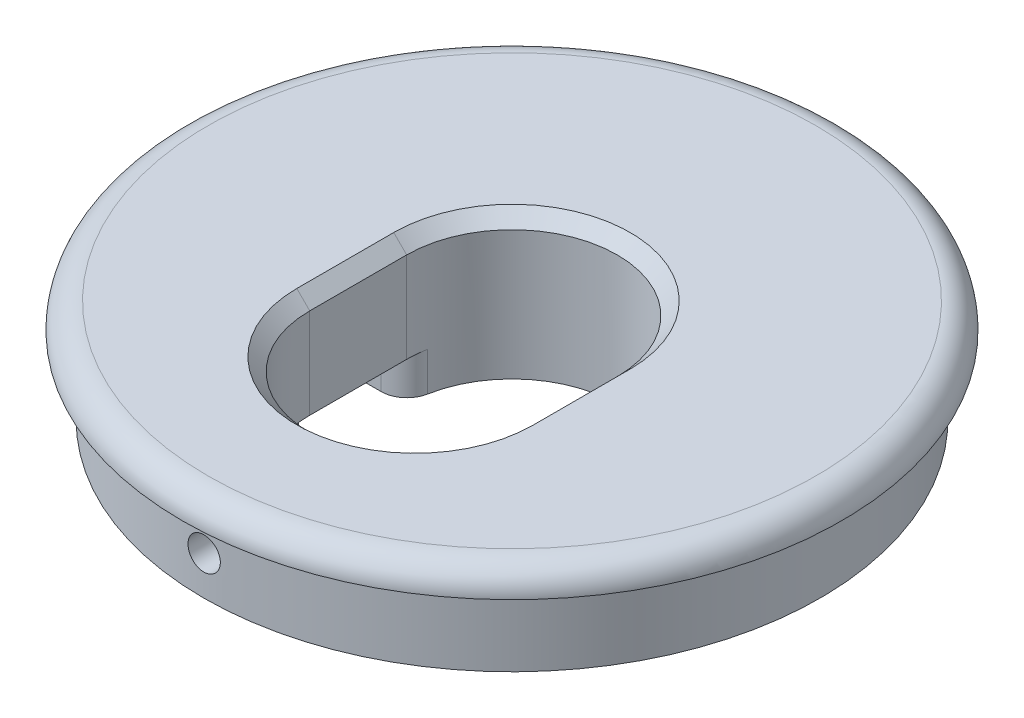
from build123d import *

# Parameters (mm, degrees)
SKETCH1_R           = 23.85
BOSS_EXTRUDE1_DEPTH = 6
SKETCH2_R           = 25.5
BOSS_EXTRUDE2_DEPTH = 2
FILLET1_R           = 2
CUT_EXTRUDE1_DEPTH  = 37.939139135
BOSS_EXTRUDE3_DEPTH = 3
SKETCH5_W           = 28
SKETCH5_H           = 7.2
CUT_EXTRUDE2_DEPTH  = 3
SKETCH6_R           = 1.25
CUT_EXTRUDE3_DEPTH  = 5
FILLET2_R           = 2
CHAMFER1_SIZE       = 1
SKETCH7_W           = 1.25
SKETCH7_H           = 8


# Some blends are built 0.0001 mm under size
with BuildPart() as part:
    # Sketch1 → Boss-Extrude1 (new body)
    with BuildSketch(Plane(origin=(0, 0, 0), x_dir=(1, 0, 0), z_dir=(0, 1, 0))):
        with Locations(Location((0, 0, 0), (0, 0, 270))):
            Circle(SKETCH1_R)
    extrude(amount=BOSS_EXTRUDE1_DEPTH)

    # Sketch2 → Boss-Extrude2 (add)
    with BuildSketch(Plane(origin=(0, 6, 0), x_dir=(1, 0, 0), z_dir=(0, 1, 0))):
        with Locations(Location((0, 0, 0), (0, 0, 270))):
            Circle(SKETCH2_R)
    extrude(amount=BOSS_EXTRUDE2_DEPTH)

    # Fillet1
    fillet1_edges = [part.edges().sort_by_distance(p)[0] for p in [
        (0, 8, -25.5),
    ]]
    fillet(fillet1_edges, radius=FILLET1_R - 0.0001)  # a hair under: the kernel refuses the full size

    # Sketch3 → Cut-Extrude1 (cut, through all)
    with BuildSketch(Plane(origin=(0, 8, 0), x_dir=(1, 0, 0), z_dir=(0, 1, 0))):
        with BuildLine():
            Line((8.15, 0), (8.15, -7.5))
            ThreePointArc((8.15, -7.5), (0, -15.65), (-8.15, -7.5))
            Line((-8.15, -7.5), (-8.15, 0))
            ThreePointArc((-8.15, 0), (0, 8.15), (8.15, 0))
        make_face()
    extrude(amount=-CUT_EXTRUDE1_DEPTH, mode=Mode.SUBTRACT)

    # Sketch4 → Boss-Extrude3 (add)
    with BuildSketch(Plane.XZ):
        with BuildLine():
            Line((-12.15, 7.5), (-12.15, 0))
            ThreePointArc((-12.15, 0), (0, -12.15), (12.15, 0))
            Line((12.15, 0), (12.15, 7.5))
            ThreePointArc((12.15, 7.5), (0, 19.65), (-12.15, 7.5))
        make_face()
        with BuildLine():
            Line((8.15, 0), (8.15, 7.5))
            ThreePointArc((8.15, 7.5), (0, 15.65), (-8.15, 7.5))
            Line((-8.15, 7.5), (-8.15, 0))
            ThreePointArc((-8.15, 0), (0, -8.15), (8.15, 0))
        make_face(mode=Mode.SUBTRACT)
    extrude(amount=BOSS_EXTRUDE3_DEPTH)

    # Sketch5 → Cut-Extrude2 (cut)
    with BuildSketch(Plane.XZ.offset(3)):
        with Locations((0, 3.75)):
            Rectangle(SKETCH5_W, SKETCH5_H)
    extrude(amount=-CUT_EXTRUDE2_DEPTH, mode=Mode.SUBTRACT)

    # Sketch6 → Cut-Extrude3 (cut)
    with BuildSketch(Plane.XZ):
        with Locations(Location((-11, 3.75, 0), (0, 0, 270))):
            Circle(SKETCH6_R)
        with Locations(Location((11, 3.75, 0), (0, 0, 270))):
            Circle(SKETCH6_R)
    extrude(amount=-CUT_EXTRUDE3_DEPTH, mode=Mode.SUBTRACT)

    # Fillet2
    # the kernel refuses this fillet: 2 mm, written as the material it takes off along each edge
    with BuildSketch(Plane(origin=(8.15, -7.5749499, 0.15), x_dir=(-0.08318438898072168, 0, -0.9965341727356388), z_dir=(0, 1, 0)), Plane(origin=(8.15, 0, 7.35), x_dir=(-0.08318438898072168, 0, 0.9965341727356388), z_dir=(0, -1, 0)), Plane(origin=(-8.15, 0, 0.15), x_dir=(0.08318438898072168, 0, -0.9965341727356388), z_dir=(0, -1, 0)), Plane(origin=(-8.15, -7.5749499, 7.35), x_dir=(0.08318438898072159, 0, 0.9965341727356388), z_dir=(0, 1, 0))) as fillet2_piece_1:
        with BuildLine():
            CenterArc((1.840842581, -1.990006343), FILLET2_R, 95.730148145, 79.498223624)
            Line((-0.152225765, -1.823637565), (-0.351532599, -1.807000688))
            Line((-0.351532599, -1.807000688), (-0.199306835, 0.016636878))
            Line((-0.199306835, 0.016636878), (0.016636878, 0.199306835))
            ThreePointArc((0.016636878, 0.199306835), (0.166117004, 0.186829176), (1.62118728, 0.199000634))
            Line((1.62118728, 0.199000634), (1.641155943, 0))
        make_face()
    extrude(amount=7.5749499, mode=Mode.SUBTRACT)

    # Chamfer1
    chamfer1_edges = [part.edges().sort_by_distance(p)[0] for p in [
        (0, 8, -8.15),
        (-8.15, 8, 3.75),
        (0, 8, 15.65),
        (8.15, 8, 3.75),
    ]]
    chamfer(chamfer1_edges, length=CHAMFER1_SIZE)

    # Sketch7 → Cut-Revolve1 (revolve, cut)
    with BuildSketch(Plane(origin=(0, 3, 0), x_dir=(-1, 0, 0), z_dir=(0, -1, 0))):
        with Locations((0.625, -21.5)):
            Rectangle(SKETCH7_W, SKETCH7_H)
    revolve(axis=Axis((0, 3, 0), (0, 0, 1)), mode=Mode.SUBTRACT)


solid = part.part
